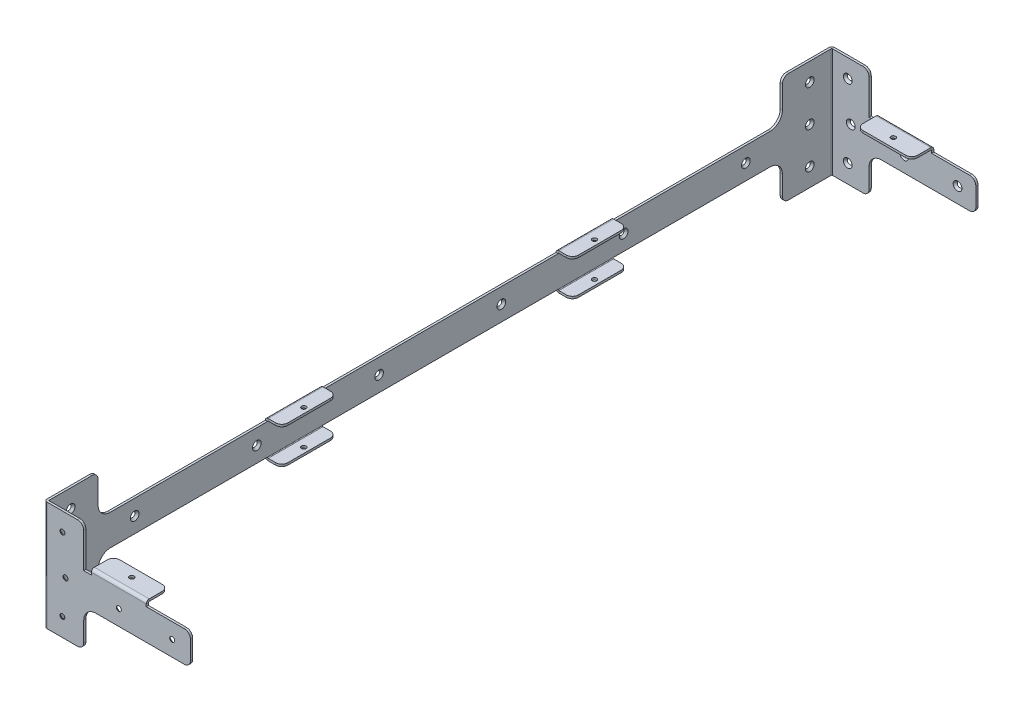
from build123d import *

# Parameters (mm, degrees)
SKETCH1_W                                         = 815.975
SKETCH1_H                                         = 33.147
BASE_FLANGE1_DEPTH                                = 2.286
EDGE_FLANGE2_STRIP_W                              = 10.8712
EDGE_FLANGE2_STRIP_H                              = 2.286
EDGE_FLANGE2_STRIP_CUT_DEPTH                      = 815.975
EDGE_FLANGE2_DEPTH                                = 815.975
EDGE_FLANGE3_STRIP_W                              = 10.8712
EDGE_FLANGE3_STRIP_H                              = 2.286
EDGE_FLANGE3_STRIP_CUT_DEPTH                      = 815.975
EDGE_FLANGE3_DEPTH                                = 815.975
EDGE_FLANGE4_STRIP_W                              = 10.8712
EDGE_FLANGE4_STRIP_H                              = 2.286
EDGE_FLANGE4_STRIP_CUT_DEPTH                      = 32.1818
EDGE_FLANGE4_DEPTH                                = 32.1818
EDGE_FLANGE6_STRIP_W                              = 10.8712
EDGE_FLANGE6_STRIP_H                              = 2.286
EDGE_FLANGE6_STRIP_CUT_DEPTH                      = 32.1818
EDGE_FLANGE6_DEPTH                                = 32.1818
CUT_EXTRUDE1_START                                = -3.0226
SKETCH18_W                                        = 17.145
SKETCH18_H                                        = 227.9015
SKETCH18_H_2                                      = 245.872
CUT_EXTRUDE1_DEPTH                                = 3.0226
CUT_EXTRUDE2_START                                = -3.0226
SKETCH23_W                                        = 17.145
SKETCH23_H                                        = 227.9015
SKETCH23_H_2                                      = 245.872
CUT_EXTRUDE2_DEPTH                                = 3.0226
EDGE_FLANGE7_DEPTH                                = 149.3774
EDGE_FLANGE7_BEND_DEPTH                           = 149.3774
CUT_EXTRUDE4_START                                = -5.4991
SKETCH46_W                                        = 46.1137
SKETCH46_H                                        = 23.01875
CUT_EXTRUDE4_DEPTH                                = 5.4991
SKETCH24_R                                        = 2.38125
CUT_EXTRUDE3_DEPTH                                = 834.161324794
CSK_FOR_8_FLAT_HEAD_SOCKET_CAP_SCREW2_D           = 4.3053
CSK_FOR_8_FLAT_HEAD_SOCKET_CAP_SCREW2_DEPTH       = 76.2
CSK_FOR_8_FLAT_HEAD_SOCKET_CAP_SCREW2_CSINK_D     = 9.1186
CSK_FOR_8_FLAT_HEAD_SOCKET_CAP_SCREW2_CSINK_ANGLE = 82
CSK_FOR_8_FLAT_HEAD_SOCKET_CAP_SCREW2_TIP         = 1.293442612
BOSS_EXTRUDE2_START                               = 39.4081
BOSS_EXTRUDE2_DEPTH                               = 39.4081
BOSS_EXTRUDE1_DEPTH                               = 42.7101
CSK_FOR_8_FLAT_HEAD_SOCKET_CAP_SCREW1_A_COUNT     = 2
CSK_FOR_8_FLAT_HEAD_SOCKET_CAP_SCREW1_A_PITCH     = 55.6387
CSK_FOR_8_FLAT_HEAD_SOCKET_CAP_SCRE_2_COUNT       = 2
CSK_FOR_8_FLAT_HEAD_SOCKET_CAP_SCRE_2_PITCH       = 111.2774
FILLET1_R                                         = 6.35
CSK_FOR_8_FLAT_HEAD_SOCKET_CAP_SCREW3_A_COUNT     = 2
CSK_FOR_8_FLAT_HEAD_SOCKET_CAP_SCREW3_A_PITCH     = 76.2
CSK_FOR_8_FLAT_HEAD_SOCKET_CAP_SCREW4_A_COUNT     = 2
CSK_FOR_8_FLAT_HEAD_SOCKET_CAP_SCREW4_A_PITCH     = 38.1
CSK_FOR_8_FLAT_HEAD_SOCKET_CAP_SCRE_3_COUNT       = 2
CSK_FOR_8_FLAT_HEAD_SOCKET_CAP_SCRE_3_PITCH       = 76.2
FILLET2_R                                         = 12.7


# Sheet-metal steps are written as plain solids
with BuildPart() as part:
    # Sketch1 → Base-Flange1 (new body)
    with BuildSketch(Plane(origin=(0, 0, 0), x_dir=(0, 0, -1), z_dir=(1, 0, 0))):
        with Locations((407.9875, 16.5735)):
            Rectangle(SKETCH1_W, SKETCH1_H)
    extrude(amount=-BASE_FLANGE1_DEPTH)

    # Edge-Flange2 strip (across the edge) → Edge-Flange2 strip cut (cut)
    with BuildSketch(Plane(origin=(0, 33.401, -815.975), x_dir=(0, -1, 0), z_dir=(0, 0, 1))):
        with Locations((-4.699, -1.143)):
            Rectangle(EDGE_FLANGE2_STRIP_W, EDGE_FLANGE2_STRIP_H)
    extrude(amount=EDGE_FLANGE2_STRIP_CUT_DEPTH, mode=Mode.SUBTRACT)

    # Edge-Flange2 section (across the edge) → Edge-Flange2 (add)
    with BuildSketch(Plane(origin=(0, 33.401, -815.975), x_dir=(0, -1, 0), z_dir=(0, 0, 1))):
        with BuildLine():
            Line((-2.286, 0.7366), (-2.286, 14.859))
            Line((-2.286, 14.859), (0, 14.859))
            Line((0, 14.859), (0, 0.7366))
            ThreePointArc((0, 0.7366), (0.215745145, 0.215745145), (0.7366, 0))
            Line((0.7366, 0), (0.7366, -2.286))
            ThreePointArc((0.7366, -2.286), (-1.400700957, -1.400700957), (-2.286, 0.7366))
        make_face()
    extrude(amount=EDGE_FLANGE2_DEPTH)

    # Edge-Flange3 strip (across the edge) → Edge-Flange3 strip cut (cut)
    with BuildSketch(Plane(origin=(0, -0.254, 0), x_dir=(0, 1, 0), z_dir=(0, 0, -1))):
        with Locations((-4.699, -1.143)):
            Rectangle(EDGE_FLANGE3_STRIP_W, EDGE_FLANGE3_STRIP_H)
    extrude(amount=EDGE_FLANGE3_STRIP_CUT_DEPTH, mode=Mode.SUBTRACT)

    # Edge-Flange3 section (across the edge) → Edge-Flange3 (add)
    with BuildSketch(Plane(origin=(0, -0.254, 0), x_dir=(0, 1, 0), z_dir=(0, 0, -1))):
        with BuildLine():
            Line((-2.286, 0.7366), (-2.286, 14.859))
            Line((-2.286, 14.859), (0, 14.859))
            Line((0, 14.859), (0, 0.7366))
            ThreePointArc((0, 0.7366), (0.215745145, 0.215745145), (0.7366, 0))
            Line((0.7366, 0), (0.7366, -2.286))
            ThreePointArc((0.7366, -2.286), (-1.400700957, -1.400700957), (-2.286, 0.7366))
        make_face()
    extrude(amount=EDGE_FLANGE3_DEPTH)

    # Edge-Flange4 strip (across the edge) → Edge-Flange4 strip cut (cut)
    with BuildSketch(Plane(origin=(0, 32.6644, 0.254), x_dir=(0, 0, -1), z_dir=(0, -1, 0))):
        with Locations((-4.699, -1.143)):
            Rectangle(EDGE_FLANGE4_STRIP_W, EDGE_FLANGE4_STRIP_H)
    extrude(amount=EDGE_FLANGE4_STRIP_CUT_DEPTH, mode=Mode.SUBTRACT)

    # Edge-Flange4 section (across the edge) → Edge-Flange4 (add)
    with BuildSketch(Plane(origin=(0, 32.6644, 0.254), x_dir=(0, 0, -1), z_dir=(0, -1, 0))):
        with BuildLine():
            Line((-2.286, 0.7366), (-2.286, 150.114))
            Line((-2.286, 150.114), (0, 150.114))
            Line((0, 150.114), (0, 0.7366))
            ThreePointArc((0, 0.7366), (0.215745145, 0.215745145), (0.7366, 0))
            Line((0.7366, 0), (0.7366, -2.286))
            ThreePointArc((0.7366, -2.286), (-1.400700957, -1.400700957), (-2.286, 0.7366))
        make_face()
    extrude(amount=EDGE_FLANGE4_DEPTH)

    # Edge-Flange6 strip (across the edge) → Edge-Flange6 strip cut (cut)
    with BuildSketch(Plane(origin=(0, 0.4826, -816.229), x_dir=(0, 0, 1), z_dir=(0, 1, 0))):
        with Locations((-4.699, -1.143)):
            Rectangle(EDGE_FLANGE6_STRIP_W, EDGE_FLANGE6_STRIP_H)
    extrude(amount=EDGE_FLANGE6_STRIP_CUT_DEPTH, mode=Mode.SUBTRACT)

    # Edge-Flange6 section (across the edge) → Edge-Flange6 (add)
    with BuildSketch(Plane(origin=(0, 0.4826, -816.229), x_dir=(0, 0, 1), z_dir=(0, 1, 0))):
        with BuildLine():
            Line((-2.286, 0.7366), (-2.286, 150.114))
            Line((-2.286, 150.114), (0, 150.114))
            Line((0, 150.114), (0, 0.7366))
            ThreePointArc((0, 0.7366), (0.215745145, 0.215745145), (0.7366, 0))
            Line((0.7366, 0), (0.7366, -2.286))
            ThreePointArc((0.7366, -2.286), (-1.400700957, -1.400700957), (-2.286, 0.7366))
        make_face()
    extrude(amount=EDGE_FLANGE6_DEPTH)

    # Sketch18 → Cut-Extrude1 (cut)
    with BuildSketch(Plane(origin=(0, 35.687, 0), x_dir=(1, 0, 0), z_dir=(0, 1, 0)).offset(CUT_EXTRUDE1_START)):
        with Locations((6.2865, 702.02425)):
            Rectangle(SKETCH18_W, SKETCH18_H)
        with Locations((6.2865, 407.9875)):
            Rectangle(SKETCH18_W, SKETCH18_H_2)
        with Locations((6.2865, 113.95075)):
            Rectangle(SKETCH18_W, SKETCH18_H)
    extrude(amount=CUT_EXTRUDE1_DEPTH, mode=Mode.SUBTRACT)

    # Sketch23 → Cut-Extrude2 (cut)
    with BuildSketch(Plane.XZ.offset(2.54).offset(CUT_EXTRUDE2_START)):
        with Locations((6.2865, -113.95075)):
            Rectangle(SKETCH23_W, SKETCH23_H)
        with Locations((6.2865, -702.02425)):
            Rectangle(SKETCH23_W, SKETCH23_H)
        with Locations((6.2865, -407.9875)):
            Rectangle(SKETCH23_W, SKETCH23_H_2)
    extrude(amount=CUT_EXTRUDE2_DEPTH, mode=Mode.SUBTRACT)

    # Edge-Flange7 section (across the edge) → Edge-Flange7 (add)
    with BuildSketch(Plane(origin=(0.7366, 35.8775, 0.254), x_dir=(0, -1, 0), z_dir=(1, 0, 0))):
        with BuildLine():
            Line((-2.286, 0.7366), (-2.286, 20.73275))
            Line((-2.286, 20.73275), (0, 20.73275))
            Line((0, 20.73275), (0, 0.7366))
            ThreePointArc((0, 0.7366), (0.215745145, 0.215745145), (0.7366, 0))
            Line((0.7366, 0), (3.2131, 0))
            Line((3.2131, 0), (3.2131, -2.286))
            Line((3.2131, -2.286), (0.7366, -2.286))
            ThreePointArc((0.7366, -2.286), (-1.400700957, -1.400700957), (-2.286, 0.7366))
        make_face()
    extrude(amount=EDGE_FLANGE7_DEPTH)

    # Edge-Flange7 section 2 (across the edge) → Edge-Flange7 bend (add)
    with BuildSketch(Plane(origin=(150.114, 35.8775, -816.229), x_dir=(0, -1, 0), z_dir=(-1, 0, 0))):
        with BuildLine():
            Line((-2.286, 0.7366), (-2.286, 20.73275))
            Line((-2.286, 20.73275), (0, 20.73275))
            Line((0, 20.73275), (0, 0.7366))
            ThreePointArc((0, 0.7366), (0.215745145, 0.215745145), (0.7366, 0))
            Line((0.7366, 0), (3.2131, 0))
            Line((3.2131, 0), (3.2131, -2.286))
            Line((3.2131, -2.286), (0.7366, -2.286))
            ThreePointArc((0.7366, -2.286), (-1.400700957, -1.400700957), (-2.286, 0.7366))
        make_face()
    extrude(amount=EDGE_FLANGE7_BEND_DEPTH)

    # Sketch46 → Cut-Extrude4 (cut)
    with BuildSketch(Plane(origin=(0, 38.1635, 0), x_dir=(1, 0, 0), z_dir=(0, 1, 0)).offset(CUT_EXTRUDE4_START)):
        with Locations((127.05715, 8.969375)):
            Rectangle(SKETCH46_W, SKETCH46_H)
        with Locations((23.79345, 8.969375)):
            Rectangle(SKETCH46_W, SKETCH46_H)
        with Locations((23.79345, 807.005625)):
            Rectangle(SKETCH46_W, SKETCH46_H)
        with Locations((127.05715, 807.005625)):
            Rectangle(SKETCH46_W, SKETCH46_H)
    extrude(amount=CUT_EXTRUDE4_DEPTH, mode=Mode.SUBTRACT)

    # Sketch24 → Cut-Extrude3 (cut, through all)
    with BuildSketch(Plane(origin=(0, 38.1635, 0), x_dir=(1, 0, 0), z_dir=(0, 1, 0))):
        with Locations((9.286875, 256.4765)):
            Circle(SKETCH24_R)
        with Locations((9.286875, 559.4985)):
            Circle(SKETCH24_R)
        with Locations(Location((75.4253, 10.95375, 0), (0, 0, 270))):
            Circle(SKETCH24_R)
        with Locations(Location((75.4253, 805.02125, 0), (0, 0, 90))):
            Circle(SKETCH24_R)
    extrude(amount=-CUT_EXTRUDE3_DEPTH, mode=Mode.SUBTRACT)

    # CSK for #8 Flat Head Socket Cap Screw2
    with Locations(Plane(origin=(0, 0, 0), x_dir=(0, 0, -1), z_dir=(1, 0, 0))):
        with Locations((89.3826, 16.5735), (216.82456, 16.5735), (344.26652, 16.5735), (471.70848, 16.5735), (599.15044, 16.5735), (726.5924, 16.5735)):
            CounterSinkHole(CSK_FOR_8_FLAT_HEAD_SOCKET_CAP_SCREW2_D / 2, CSK_FOR_8_FLAT_HEAD_SOCKET_CAP_SCREW2_CSINK_D / 2, depth=CSK_FOR_8_FLAT_HEAD_SOCKET_CAP_SCREW2_DEPTH, counter_sink_angle=CSK_FOR_8_FLAT_HEAD_SOCKET_CAP_SCREW2_CSINK_ANGLE)
            with Locations((0, 0, -(CSK_FOR_8_FLAT_HEAD_SOCKET_CAP_SCREW2_DEPTH + CSK_FOR_8_FLAT_HEAD_SOCKET_CAP_SCREW2_TIP / 2))):  # 118° drill point
                Cone(0, CSK_FOR_8_FLAT_HEAD_SOCKET_CAP_SCREW2_D / 2, CSK_FOR_8_FLAT_HEAD_SOCKET_CAP_SCREW2_TIP, mode=Mode.SUBTRACT)

    # Sketch66 → Boss-Extrude2 (add)
    with BuildSketch(Plane.XZ.offset(-0.4826).offset(BOSS_EXTRUDE2_START)):
        with BuildLine():
            Line((-2.286, -764.6924), (0, -764.6924))
            Line((0, -764.6924), (0, -815.4924))
            ThreePointArc((0, -815.4924), (0.215745145, -816.013254855), (0.7366, -816.229))
            Line((0.7366, -816.229), (38.8366, -816.229))
            Line((38.8366, -816.229), (38.8366, -818.515))
            Line((38.8366, -818.515), (0.7366, -818.515))
            ThreePointArc((0.7366, -818.515), (-1.400700957, -817.629700957), (-2.286, -815.4924))
            Line((-2.286, -815.4924), (-2.286, -764.6924))
        make_face()
    boss_extrude2 = extrude(amount=-BOSS_EXTRUDE2_DEPTH)

    # Sketch65 → Boss-Extrude1 (add)
    with BuildSketch(Plane(origin=(0, 32.6644, 0), x_dir=(1, 0, 0), z_dir=(0, 1, 0))):
        with BuildLine():
            Line((-2.286, 764.6924), (-2.286, 815.4924))
            ThreePointArc((-2.286, 815.4924), (-1.400700957, 817.629700957), (0.7366, 818.515))
            Line((0.7366, 818.515), (38.8366, 818.515))
            Line((38.8366, 818.515), (38.8366, 816.229))
            Line((38.8366, 816.229), (0.7366, 816.229))
            ThreePointArc((0.7366, 816.229), (0.215745145, 816.013254855), (0, 815.4924))
            Line((0, 815.4924), (0, 764.6924))
            Line((0, 764.6924), (-2.286, 764.6924))
        make_face()
    boss_extrude1 = extrude(amount=BOSS_EXTRUDE1_DEPTH)

    # Sketch60 → CSK for #8 Flat Head Socket Cap Screw1 (revolve, cut)
    with BuildSketch(Plane(origin=(131.064, 16.5735, 0.254), x_dir=(0, 1, 0), z_dir=(1, 0, 0))):
        Polygon((0, 0), (0, 77.493442612), (2.15265, 76.2), (2.15265, 2.768534127), (4.5593, 0), align=None)
    csk_for_8_flat_head_socket_cap_screw1 = revolve(axis=Axis((131.064, 16.5735, -6.096), (0, 0, 1)), mode=Mode.SUBTRACT)

    # CSK for #8 Flat Head Socket Cap Screw1 a: CSK for #8 Flat Head Socket Cap Screw1 ×2
    with Locations(*[(-i * CSK_FOR_8_FLAT_HEAD_SOCKET_CAP_SCREW1_A_PITCH, 0, 0) for i in range(1, CSK_FOR_8_FLAT_HEAD_SOCKET_CAP_SCREW1_A_COUNT)]):
        add(csk_for_8_flat_head_socket_cap_screw1, mode=Mode.SUBTRACT)

    # CSK for _8 Flat Head Socket Cap Scre 2: CSK for #8 Flat Head Socket Cap Screw1 ×2
    with Locations(*[(-i * CSK_FOR_8_FLAT_HEAD_SOCKET_CAP_SCRE_2_PITCH, 0, 0) for i in range(1, CSK_FOR_8_FLAT_HEAD_SOCKET_CAP_SCRE_2_COUNT)]):
        add(csk_for_8_flat_head_socket_cap_screw1, mode=Mode.SUBTRACT)

    # Mirror1: Boss-Extrude2, Boss-Extrude1, CSK for #8 Flat Head Socket Cap Screw1 across plane
    add(boss_extrude2.mirror(Plane(origin=(0, 0, -407.9875), x_dir=(1, 0, 0), z_dir=(0, 0, -1))))
    add(boss_extrude1.mirror(Plane(origin=(0, 0, -407.9875), x_dir=(1, 0, 0), z_dir=(0, 0, -1))))
    add(csk_for_8_flat_head_socket_cap_screw1.mirror(Plane(origin=(0, 0, -407.9875), x_dir=(1, 0, 0), z_dir=(0, 0, -1))), mode=Mode.SUBTRACT)

    # Mirror1 copy 1 sketch → Mirror1 copy 1 (revolve, cut)
    with BuildSketch(Plane(origin=(75.4253, 16.5735, -816.229), x_dir=(0, 1, 0), z_dir=(1, 0, 0))):
        Polygon((0, 0), (0, -77.493442612), (2.15265, -76.2), (2.15265, -2.768534127), (4.5593, 0), align=None)
    revolve(axis=Axis((75.4253, 16.5735, -809.879), (0, 0, 1)), mode=Mode.SUBTRACT)

    # Mirror1 copy 2 sketch → Mirror1 copy 2 (revolve, cut)
    with BuildSketch(Plane(origin=(19.7866, 16.5735, -816.229), x_dir=(0, 1, 0), z_dir=(1, 0, 0))):
        Polygon((0, 0), (0, -77.493442612), (2.15265, -76.2), (2.15265, -2.768534127), (4.5593, 0), align=None)
    revolve(axis=Axis((19.7866, 16.5735, -809.879), (0, 0, 1)), mode=Mode.SUBTRACT)

    # Fillet1
    fillet1_edges = [part.edges().sort_by_distance(p)[0] for p in [
        (150.114, 0.4826, 1.397),
        (150.114, 0.4826, -817.372),
        (14.859, 34.544, -588.0735),
        (14.859, 34.544, -530.9235),
        (14.859, 34.544, -285.0515),
        (14.859, 34.544, -227.9015),
        (14.859, -1.397, -588.0735),
        (14.859, -1.397, -285.0515),
        (14.859, -1.397, -530.9235),
        (14.859, -1.397, -227.9015),
        (104.0003, 37.0205, -20.47875),
        (150.114, 32.6644, 1.397),
        (46.8503, 37.0205, -795.49625),
        (150.114, 32.6644, -817.372),
        (104.0003, 37.0205, -795.49625),
        (46.8503, 37.0205, -20.47875),
        (38.8366, -38.9255, -817.372),
        (-1.143, -38.9255, -764.6924),
        (-1.143, 75.3745, -764.6924),
        (38.8366, 75.3745, -817.372),
        (-1.143, -38.9255, -51.2826),
        (38.8366, -38.9255, 1.397),
        (-1.143, 75.3745, -51.2826),
        (38.8366, 75.3745, 1.397),
    ]]
    fillet(fillet1_edges, radius=FILLET1_R)

    # Sketch68 → CSK for #8 Flat Head Socket Cap Screw3 (revolve, cut)
    with BuildSketch(Plane(origin=(16.6116, 56.3245, 0.254), x_dir=(0, 1, 0), z_dir=(1, 0, 0))):
        Polygon((0, 0), (0, 2.286), (2.15265, 2.286), (2.15265, 2.768534127), (4.5593, 0), align=None)
    csk_for_8_flat_head_socket_cap_screw3 = revolve(axis=Axis((16.6116, 56.3245, -6.096), (0, 0, 1)), mode=Mode.SUBTRACT)

    # CSK for #8 Flat Head Socket Cap Screw3 a: CSK for #8 Flat Head Socket Cap Screw3 ×2
    with Locations(*[(0, -i * CSK_FOR_8_FLAT_HEAD_SOCKET_CAP_SCREW3_A_PITCH, 0) for i in range(1, CSK_FOR_8_FLAT_HEAD_SOCKET_CAP_SCREW3_A_COUNT)]):
        add(csk_for_8_flat_head_socket_cap_screw3, mode=Mode.SUBTRACT)

    # Sketch70 → CSK for #8 Flat Head Socket Cap Screw4 (revolve, cut)
    with BuildSketch(Plane(origin=(0, 56.3245, -22.7076), x_dir=(0, 0, -1), z_dir=(0, 1, 0))):
        Polygon((0, 0), (0, 2.286), (2.15265, 2.286), (2.15265, 2.768534127), (4.5593, 0), align=None)
    csk_for_8_flat_head_socket_cap_screw4 = revolve(axis=Axis((6.35, 56.3245, -22.7076), (-1, 0, 0)), mode=Mode.SUBTRACT)

    # CSK for #8 Flat Head Socket Cap Screw4 a: CSK for #8 Flat Head Socket Cap Screw4 ×2
    with Locations(*[(0, -i * CSK_FOR_8_FLAT_HEAD_SOCKET_CAP_SCREW4_A_PITCH, 0) for i in range(1, CSK_FOR_8_FLAT_HEAD_SOCKET_CAP_SCREW4_A_COUNT)]):
        add(csk_for_8_flat_head_socket_cap_screw4, mode=Mode.SUBTRACT)

    # CSK for _8 Flat Head Socket Cap Scre 3: CSK for #8 Flat Head Socket Cap Screw4 ×2
    with Locations(*[(0, -i * CSK_FOR_8_FLAT_HEAD_SOCKET_CAP_SCRE_3_PITCH, 0) for i in range(1, CSK_FOR_8_FLAT_HEAD_SOCKET_CAP_SCRE_3_COUNT)]):
        add(csk_for_8_flat_head_socket_cap_screw4, mode=Mode.SUBTRACT)

    # Mirror2: CSK for #8 Flat Head Socket Cap Screw3, CSK for #8 Flat Head Socket Cap Screw4 across plane
    add(csk_for_8_flat_head_socket_cap_screw3.mirror(Plane(origin=(0, 0, -407.9875), x_dir=(1, 0, 0), z_dir=(0, 0, -1))), mode=Mode.SUBTRACT)
    add(csk_for_8_flat_head_socket_cap_screw4.mirror(Plane(origin=(0, 0, -407.9875), x_dir=(1, 0, 0), z_dir=(0, 0, -1))), mode=Mode.SUBTRACT)

    # Mirror2 copy 1 sketch → Mirror2 copy 1 (revolve, cut)
    with BuildSketch(Plane(origin=(16.6116, -19.8755, -816.229), x_dir=(0, 1, 0), z_dir=(1, 0, 0))):
        Polygon((0, 0), (0, -2.286), (2.15265, -2.286), (2.15265, -2.768534127), (4.5593, 0), align=None)
    revolve(axis=Axis((16.6116, -19.8755, -809.879), (0, 0, 1)), mode=Mode.SUBTRACT)

    # Mirror2 copy 2 sketch → Mirror2 copy 2 (revolve, cut)
    with BuildSketch(Plane(origin=(0, 18.2245, -793.2674), x_dir=(0, 0, 1), z_dir=(0, 1, 0))):
        Polygon((0, 0), (0, -2.286), (2.15265, -2.286), (2.15265, -2.768534127), (4.5593, 0), align=None)
    revolve(axis=Axis((6.35, 18.2245, -793.2674), (1, 0, 0)), mode=Mode.SUBTRACT)

    # Mirror2 copy 3 sketch → Mirror2 copy 3 (revolve, cut)
    with BuildSketch(Plane(origin=(0, -19.8755, -793.2674), x_dir=(0, 0, 1), z_dir=(0, 1, 0))):
        Polygon((0, 0), (0, -2.286), (2.15265, -2.286), (2.15265, -2.768534127), (4.5593, 0), align=None)
    revolve(axis=Axis((6.35, -19.8755, -793.2674), (1, 0, 0)), mode=Mode.SUBTRACT)

    # Fillet2
    fillet2_edges = [part.edges().sort_by_distance(p)[0] for p in [
        (38.8366, 0.4826, -817.372),
        (-1.143, 0.4826, -764.6924),
        (-1.143, 32.6644, -764.6924),
        (-1.143, 0.4826, -51.2826),
        (38.8366, 0.4826, 1.397),
        (-1.143, 32.6644, -51.2826),
    ]]
    fillet(fillet2_edges, radius=FILLET2_R)


solid = part.part
